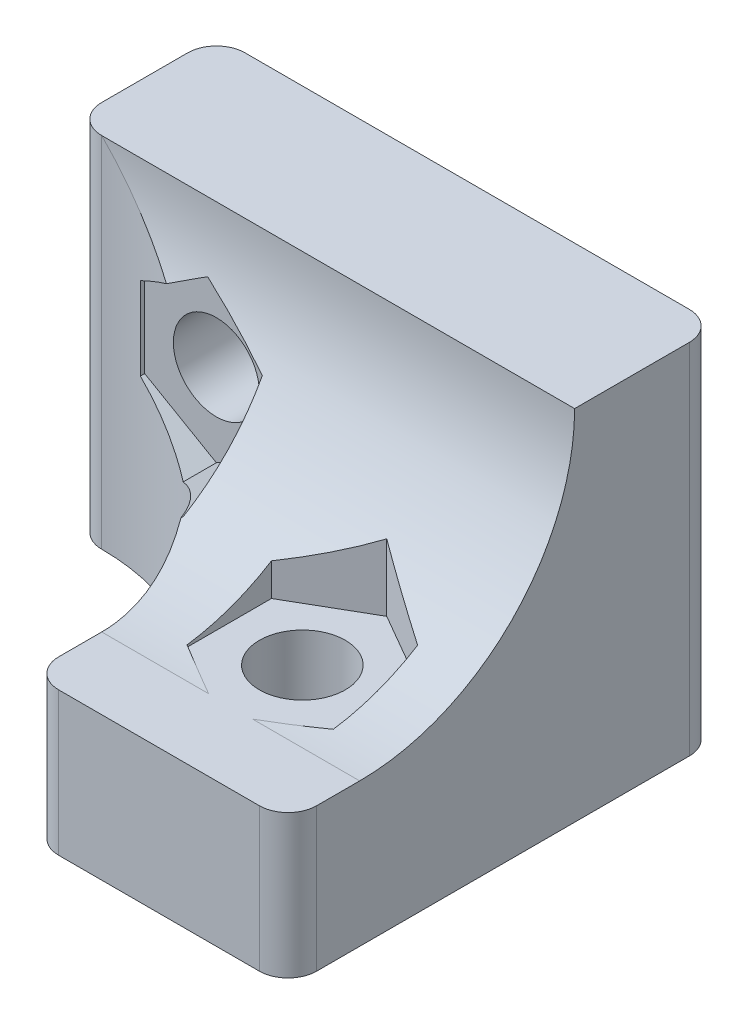
from build123d import *

# Parameters (mm, degrees)
SKETCH1_W           = 35
SKETCH1_H           = 25
BOSS_EXTRUDE1_DEPTH = 10
SKETCH2_R           = 3
CUT_EXTRUDE1_DEPTH  = 24.717082451
SKETCH3_W           = 18
SKETCH3_H           = 10
BOSS_EXTRUDE2_DEPTH = 20
SKETCH4_R           = 3
CUT_EXTRUDE2_DEPTH  = 38.831864876
FILLET2_R           = 15
FILLET3_R           = 2
CUT_EXTRUDE3_START  = -10
SKETCH5_R           = 3
CUT_EXTRUDE3_DEPTH  = 27.912057737
CUT_EXTRUDE4_START  = -10
CUT_EXTRUDE4_DEPTH  = 33.793107029


# Some blends are built 0.0001 mm under size
with BuildPart() as part:
    # Sketch1 → Boss-Extrude1 (new body)
    with BuildSketch(Plane.XY):
        Rectangle(SKETCH1_W, SKETCH1_H)
    extrude(amount=BOSS_EXTRUDE1_DEPTH)

    # Sketch2 → Cut-Extrude1 (cut, through all)
    with BuildSketch(Plane.XY.offset(10)):
        with Locations((-7.5, 2.5)):
            Circle(SKETCH2_R)
    extrude(amount=-CUT_EXTRUDE1_DEPTH, mode=Mode.SUBTRACT)

    # Sketch3 → Boss-Extrude2 (add)
    with BuildSketch(Plane.XY.offset(10)):
        with Locations((8.5, -7.5)):
            Rectangle(SKETCH3_W, SKETCH3_H)
    extrude(amount=BOSS_EXTRUDE2_DEPTH)

    # Sketch4 → Cut-Extrude2 (cut, through all)
    with BuildSketch(Plane(origin=(0, -2.5, 0), x_dir=(1, 0, 0), z_dir=(0, 1, 0))):
        with Locations(Location((8.5, -20, 0), (0, 0, 180))):
            Circle(SKETCH4_R)
    extrude(amount=-CUT_EXTRUDE2_DEPTH, mode=Mode.SUBTRACT)

    # Fillet2
    # the kernel refuses this fillet: 15 mm, written as the material it adds along each edge
    with BuildSketch(Plane(origin=(-0.5, -12.5, 10), x_dir=(-1, 0, 0), z_dir=(0, 1, 0))) as fillet2_piece_1:
        with BuildLine():
            CenterArc((FILLET2_R, FILLET2_R), FILLET2_R, 180, 90)
            Line((0, FILLET2_R), (0, 0))
            Line((0, 0), (FILLET2_R, 0))
        make_face()
    extrude(amount=10)
    with BuildSketch(Plane(origin=(-0.5, -2.5, 10), x_dir=(0, 1, 0), z_dir=(1, 0, 0))) as fillet2_piece_2_section:
        with BuildLine():
            CenterArc((FILLET2_R, FILLET2_R), FILLET2_R, 180, 90)
            Line((0, FILLET2_R), (0, 0))
            Line((0, 0), (FILLET2_R, 0))
        make_face()
    fillet2_piece_2 = extrude(amount=18, mode=Mode.PRIVATE)
    fillet2_piece_2 = fillet2_piece_2 - Plane(origin=(8.5, 1.000391612, 20), x_dir=(-1, 0, 0), z_dir=(0, 1, 0)) * Cylinder(3, 96, mode=Mode.PRIVATE)
    add(fillet2_piece_2)
    with BuildSketch(Plane(origin=(-0.5, -12.5, 10), x_dir=(-1, 0, 0), z_dir=(0, 1, 0))) as fillet2_piece_3a_section:
        with BuildLine():
            CenterArc((FILLET2_R, FILLET2_R), FILLET2_R, 180, 90)
            Line((0, FILLET2_R), (0, 0))
            Line((0, 0), (FILLET2_R, 0))
        make_face()
    fillet2_piece_3a = extrude(amount=47.5, mode=Mode.PRIVATE)
    fillet2_piece_3a = split(fillet2_piece_3a, bisect_by=Plane(origin=(-3.591955578, 12.5, 13.608814387), z_dir=(0, -1, 0)), keep=Keep.TOP, mode=Mode.PRIVATE)
    fillet2_piece_3a = fillet2_piece_3a - Plane(origin=(-7.5, 2.5, 13.608814387), x_dir=(1, 0, 0), z_dir=(0, 0, 1)) * Cylinder(3, 155, mode=Mode.PRIVATE)
    fillet2_piece_3a = split(fillet2_piece_3a, bisect_by=Plane(origin=(-3.591955578, -2.5, 13.608814387), z_dir=(0, 1, 0)), keep=Keep.TOP, mode=Mode.PRIVATE)
    with BuildSketch(Plane(origin=(-38, -2.5, 10), x_dir=(0, 1, 0), z_dir=(1, 0, 0))) as fillet2_piece_3b_section:
        with BuildLine():
            CenterArc((FILLET2_R, FILLET2_R), FILLET2_R, 180, 90)
            Line((0, FILLET2_R), (0, 0))
            Line((0, 0), (FILLET2_R, 0))
        make_face()
    fillet2_piece_3b = extrude(amount=55.5, mode=Mode.PRIVATE)
    fillet2_piece_3b = split(fillet2_piece_3b, bisect_by=Plane(origin=(-17.5, 8.593163462, 10.419487544), z_dir=(1, 0, 0)), keep=Keep.TOP, mode=Mode.PRIVATE)
    fillet2_piece_3b = fillet2_piece_3b - Plane(origin=(-7.5, 2.5, 10.419487544), x_dir=(1, 0, 0), z_dir=(0, 0, 1)) * Cylinder(3, 171, mode=Mode.PRIVATE)
    fillet2_piece_3b = split(fillet2_piece_3b, bisect_by=Plane(origin=(-0.5, 8.593163462, 10.419487544), z_dir=(-1, 0, 0)), keep=Keep.TOP, mode=Mode.PRIVATE)
    fillet2_piece_3 = fillet2_piece_3a & fillet2_piece_3b
    add(fillet2_piece_3)

    # Fillet3
    fillet3_edges = [part.edges().sort_by_distance(p)[0] for p in [
        (17.5, 0, 0),
        (-17.5, 0, 0),
        (-17.5, 0, 10),
        (-0.5, -7.5, 30),
        (17.5, -7.5, 30),
    ]]
    fillet(fillet3_edges, radius=FILLET3_R - 0.0001)  # a hair under: the kernel refuses the full size

    # Sketch5 → Cut-Extrude3 (cut, through all)
    with BuildSketch(Plane(origin=(0, 0, 0), x_dir=(-1, 0, 0), z_dir=(0, 0, -1)).offset(CUT_EXTRUDE3_START)):
        Polygon((2.5, 5.386751346), (2.5, -0.386751346), (7.5, -3.273502692), (12.5, -0.386751346), (12.5, 5.386751346), (7.5, 8.273502692), align=None)
        with Locations(Location((7.5, 2.5, 0), (0, 0, 180))):
            Circle(SKETCH5_R, mode=Mode.SUBTRACT)
    extrude(amount=-CUT_EXTRUDE3_DEPTH, mode=Mode.SUBTRACT)

    # Sketch6 → Cut-Extrude4 (cut, through all)
    with BuildSketch(Plane.XZ.offset(12.5).offset(CUT_EXTRUDE4_START)):
        Polygon((8.5, 14.111027254), (13.6, 17.055513627), (13.6, 22.944486373), (8.5, 25.888972746), (3.4, 22.944486373), (3.4, 17.055513627), align=None)
    extrude(amount=-CUT_EXTRUDE4_DEPTH, mode=Mode.SUBTRACT)


solid = part.part
